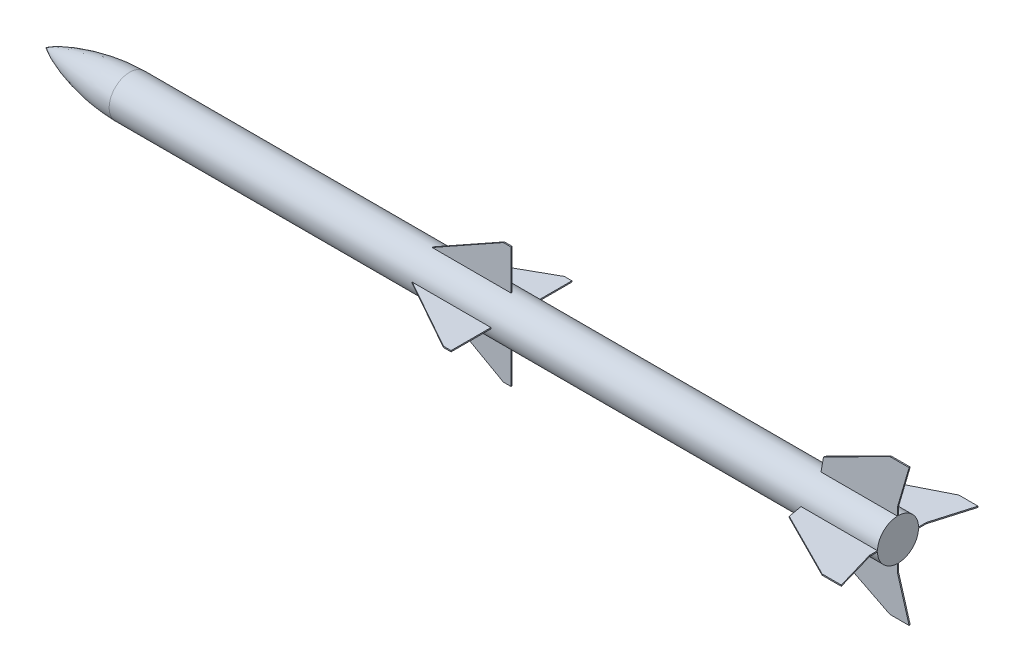
from build123d import *

# Parameters (mm, degrees)
BOSS_EXTRUDE1_DEPTH   = 0.529212532
BOSS_EXTRUDE1_2_DEPTH = 0.529212532
CIRPATTERN1_COUNT     = 4
SCALE1_SCALE          = 4.724
BODY_MOVE_COPY1_ANGLE = 90


with BuildPart() as part:
    # Sketch1 → Revolve1 (revolve)
    with BuildSketch(Plane.XY, mode=Mode.PRIVATE) as revolve1_sk:
        with BuildLine():
            Line((111.973953624, 86.213943438), (810.204439049, 86.213943438))
            Line((810.204439049, 86.213943438), (810.204439049, 67.543714902))
            Line((810.204439049, 67.543714902), (35.915373063, 67.543714902))
            add(Edge.make_bspline(
                [(35.915373063, 67.543714902), (64.316707395, 86.213943438), (111.973953624, 86.213943438)],
                knots=[0, 0, 0, 1, 1, 1], degree=2, weights=[1, 0.685812689, 1]))
        make_face()
    revolve(revolve1_sk.sketch.rotate(Axis((35.915373063, 67.543714902, 0), (1, 0, 0)), 90), axis=Axis((35.915373063, 67.543714902, 0), (1, 0, 0)))


with BuildPart() as body_2:
    # Sketch2 → Boss-Extrude1 (new, symmetric)
    with BuildSketch(Plane.XY):
        Polygon((387.383276717, 83.038943438), (458.945056672, 83.038943438), (458.945056672, 122.452801344), (452.070125847, 122.452801344), (387.383276717, 86.213943438), align=None)
    extrude(amount=BOSS_EXTRUDE1_DEPTH, both=True)


with BuildPart() as body_3:
    # Sketch2 → Boss-Extrude1 2 (new, symmetric)
    with BuildSketch(Plane.XY):
        Polygon((740.77939896, 86.213943438), (740.77939896, 83.038943438), (810.204439049, 83.038943438), (810.204439049, 86.213943438), (810.204439049, 93.370738151), (820.800846483, 129.653166351), (803.38333804, 129.653166351), (743.031647149, 99.208669237), align=None)
    extrude(amount=BOSS_EXTRUDE1_2_DEPTH, both=True)


with BuildPart() as cirpattern1_1:
    # CirPattern1: pattern copy
    add(body_3.part.rotate(Axis((0, 67.543714902, 0), (1, 0, 0)), 1 * 360 / CIRPATTERN1_COUNT))


with BuildPart() as cirpattern1_2:
    # CirPattern1: pattern copy
    add(body_3.part.rotate(Axis((0, 67.543714902, 0), (1, 0, 0)), 2 * 360 / CIRPATTERN1_COUNT))


with BuildPart() as cirpattern1_3:
    # CirPattern1: pattern copy
    add(body_3.part.rotate(Axis((0, 67.543714902, 0), (1, 0, 0)), 3 * 360 / CIRPATTERN1_COUNT))


with BuildPart() as cirpattern1_4:
    # CirPattern1: pattern copy
    add(body_2.part.rotate(Axis((0, 67.543714902, 0), (1, 0, 0)), 1 * 360 / CIRPATTERN1_COUNT))


with BuildPart() as cirpattern1_5:
    # CirPattern1: pattern copy
    add(body_2.part.rotate(Axis((0, 67.543714902, 0), (1, 0, 0)), 2 * 360 / CIRPATTERN1_COUNT))


with BuildPart() as cirpattern1_6:
    # CirPattern1: pattern copy
    add(body_2.part.rotate(Axis((0, 67.543714902, 0), (1, 0, 0)), 3 * 360 / CIRPATTERN1_COUNT))


with BuildPart() as part_1:
    add(part.part)

    # Combine1: union CirPattern1_4, body 2, CirPattern1_6, CirPattern1_5, body 3, CirPattern1_1, CirPattern1_3, CirPattern1_2
    add(cirpattern1_4.part)
    add(body_2.part)
    add(cirpattern1_6.part)
    add(cirpattern1_5.part)
    add(body_3.part)
    add(cirpattern1_1.part)
    add(cirpattern1_3.part)
    add(cirpattern1_2.part)


with BuildPart() as part_2:
    # Scale1: scaled about (0, 0, 0)
    add(part_1.part.scale(SCALE1_SCALE))


with BuildPart() as part_3:
    # Body-Move/Copy1: read off the stored shape, not the designer's step
    # Body-Move/Copy1: moved
    add(part_2.part.moved(Location((-169.6642223, -319.0765092, 0))).rotate(Axis((0, 0, 0), (1, 0, 0)), BODY_MOVE_COPY1_ANGLE))


solid = part_3.part
